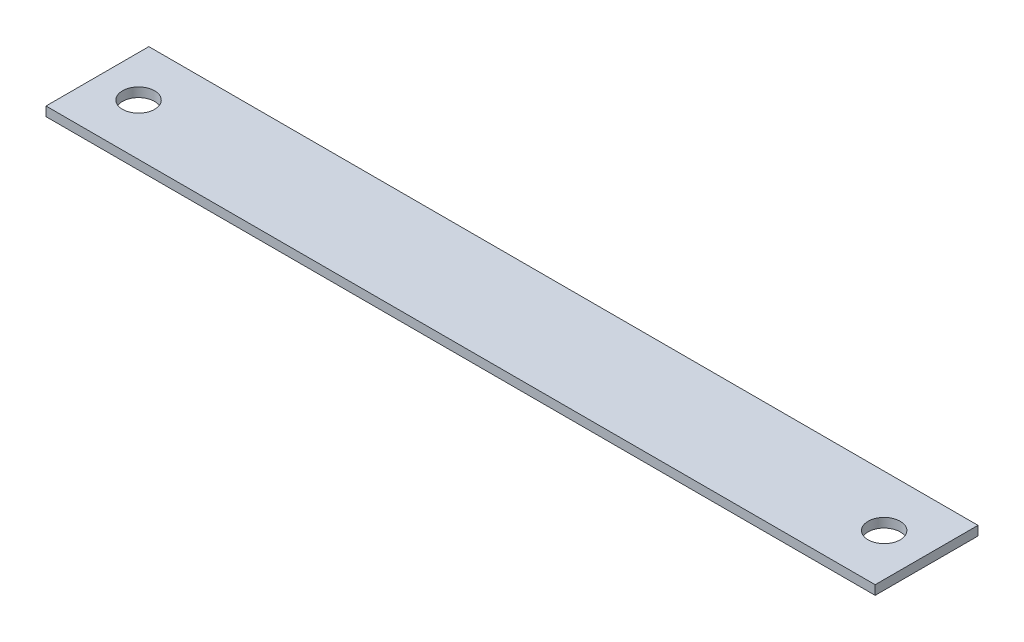
from build123d import *

# Parameters (mm, degrees)
SKETCH1_W           = 204.7875
SKETCH1_H           = 25.4
BOSS_EXTRUDE1_DEPTH = 2.286
SKETCH2_R           = 3.96875
CUT_EXTRUDE1_DEPTH  = 207.369343538


with BuildPart() as part:
    # Sketch1 → Boss-Extrude1 (new body)
    with BuildSketch(Plane(origin=(0, 0, 0), x_dir=(1, 0, 0), z_dir=(0, 1, 0))):
        with Locations((102.39375, 12.7)):
            Rectangle(SKETCH1_W, SKETCH1_H)
    extrude(amount=BOSS_EXTRUDE1_DEPTH)

    # Sketch2 → Cut-Extrude1 (cut, through all)
    with BuildSketch(Plane(origin=(0, 2.286, 0), x_dir=(1, 0, 0), z_dir=(0, 1, 0))):
        with Locations((10.16, 12.7)):
            Circle(SKETCH2_R)
        with Locations((194.31, 12.7)):
            Circle(SKETCH2_R)
    extrude(amount=-CUT_EXTRUDE1_DEPTH, mode=Mode.SUBTRACT)


solid = part.part
